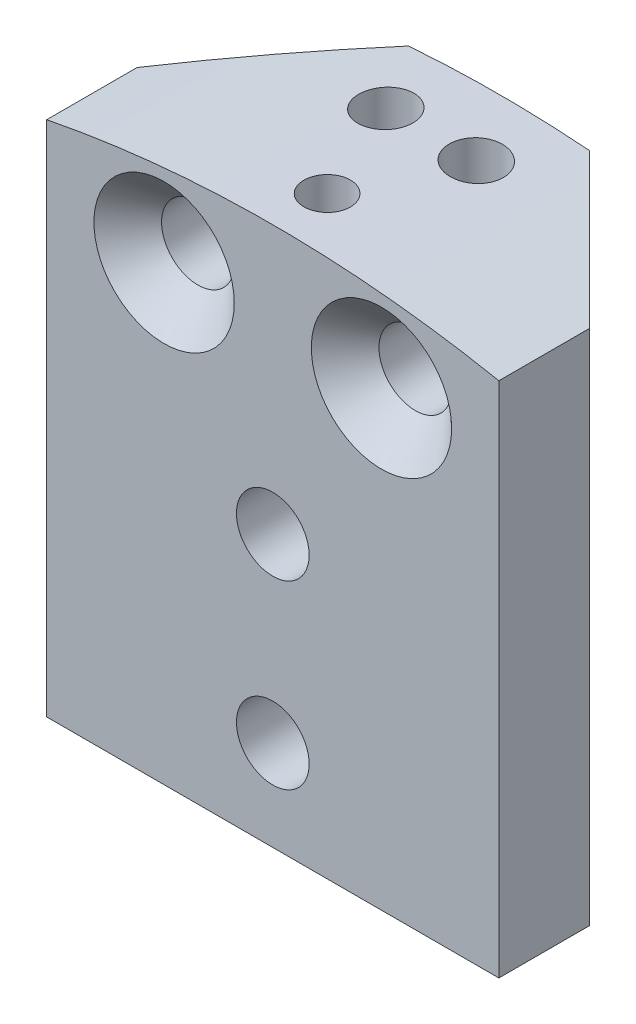
from build123d import *

# Parameters (mm, degrees)
SKETCH1_W                    = 50.8
SKETCH1_H                    = 38.1
BOSS_EXTRUDE1_DEPTH          = 15.875
F_1_4_20_TAPPED_HOLE1_D      = 5.1054
CUT_EXTRUDE1_DEPTH           = 36.497579143
CUT_EXTRUDE1_DEPTH_BACK      = 36.497579143
SKETCH5_W                    = 73.284203365
SKETCH5_H                    = 114.763304797
CUT_EXTRUDE3_DEPTH           = 36.497579143
CUT_EXTRUDE3_DRAFT           = 45
CUT_EXTRUDE3_PROFILE_2_DEPTH = 36.497579143
CUT_EXTRUDE3_PROFILE_2_DRAFT = 45
CUT_EXTRUDE5_DEPTH           = 34.299680929
CUT_EXTRUDE5_DEPTH_BACK      = 34.299680929
SKETCH7_W                    = 138.535058429
SKETCH7_H                    = 124.054324336
SKETCH7_W_2                  = 31.75
SKETCH7_H_2                  = 70.377244636
F_1_4_20_TAPPED_HOLE2_D      = 5.1054
F_10_24_TAPPED_HOLE2_D       = 3.7973
F_10_24_TAPPED_HOLE2_DEPTH   = 12.7
F_10_24_TAPPED_HOLE2_TIP     = 1.140824014
CUT_EXTRUDE6_DEPTH           = 6.35


with BuildPart() as part:
    # Sketch1 → Boss-Extrude1 (new body)
    with BuildSketch(Plane.XY):
        Rectangle(SKETCH1_W, SKETCH1_H)
    extrude(amount=BOSS_EXTRUDE1_DEPTH)

    # 1/4-20 Tapped Hole1 (through all)
    with Locations(Plane.XY.offset(15.875)):
        with Locations((7.6327, 12.7), (-7.6327, 12.7)):
            Hole(F_1_4_20_TAPPED_HOLE1_D / 2)

    # Sketch4 → Cut-Extrude1 (cut, two sides: drawn at the far end of the back side and taken through both)
    with BuildSketch(Plane.XY.offset(15.875).offset(-CUT_EXTRUDE1_DEPTH_BACK)):
        with BuildLine():
            Line((-39.282326984, 8.793789894), (-52.704404265, 33.364356416))
            Line((-52.704404265, 33.364356416), (0, 61.927684543))
            Line((0, 61.927684543), (62.667848215, 36.771765562))
            Line((62.667848215, 36.771765562), (48.5918884, 2.86093959))
            ThreePointArc((48.5918884, 2.86093959), (5.519661368, 18.637515941), (-39.282326984, 8.793789894))
        make_face()
    extrude(amount=CUT_EXTRUDE1_DEPTH + CUT_EXTRUDE1_DEPTH_BACK, mode=Mode.SUBTRACT)


with BuildPart() as cut_extrude3_tool:
    # Sketch5 → Cut-Extrude3 (with draft: the straight prism first)
    with BuildSketch(Plane.XY):
        with Locations((-42.992101682, 7.874882724)):
            Rectangle(SKETCH5_W, SKETCH5_H)
    extrude(amount=CUT_EXTRUDE3_DEPTH)
    # Cut-Extrude3: the draft: its side faces are tilted about the plane it starts from
    cut_extrude3_sides = [cut_extrude3_tool.faces().sort_by_distance(p)[0] for p in [
        (-42.992101682, 65.256535122, 18.248789571),
        (-79.634203365, 7.874882724, 18.248789571),
        (-42.992101682, -49.506769675, 18.248789571),
        (-6.35, 7.874882724, 18.248789571),
    ]]
    draft(cut_extrude3_sides, Plane.XY, CUT_EXTRUDE3_DRAFT)


with BuildPart() as part_1:
    add(part.part)

    # Cut-Extrude3: cut by cut_extrude3_tool
    add(cut_extrude3_tool.part, mode=Mode.SUBTRACT)


with BuildPart() as cut_extrude3_profile_2_tool:
    # Sketch5 → Cut-Extrude3 profile 2 (with draft: the straight prism first)
    with BuildSketch(Plane.XY):
        with Locations((42.992101682, 7.874882724)):
            Rectangle(SKETCH5_W, SKETCH5_H)
    extrude(amount=CUT_EXTRUDE3_PROFILE_2_DEPTH)
    # Cut-Extrude3 profile 2: the draft: its side faces are tilted about the plane it starts from
    cut_extrude3_profile_2_sides = [cut_extrude3_profile_2_tool.faces().sort_by_distance(p)[0] for p in [
        (42.992101682, 65.256535122, 18.248789571),
        (6.35, 7.874882724, 18.248789571),
        (42.992101682, -49.506769675, 18.248789571),
        (79.634203365, 7.874882724, 18.248789571),
    ]]
    draft(cut_extrude3_profile_2_sides, Plane.XY, CUT_EXTRUDE3_PROFILE_2_DRAFT)


with BuildPart() as part_2:
    add(part_1.part)

    # Cut-Extrude3 profile 2: cut by cut_extrude3_profile_2_tool
    add(cut_extrude3_profile_2_tool.part, mode=Mode.SUBTRACT)

    # Cut-Extrude4 cone 1 section (through the dimple's axis) → Cut-Extrude4 (revolve, cut)
    with BuildSketch(Plane(origin=(-7.6327, 12.7, 15.875), x_dir=(0, -1, 0), z_dir=(1, 0, 0))):
        Polygon((0, 0), (4.9276, 0), (0, 4.9276), align=None)
    revolve(axis=Axis((-7.6327, 12.7, 15.875), (0, 0, -1)), mode=Mode.SUBTRACT)

    # Cut-Extrude4 cone 2 section (through the dimple's axis) → Cut-Extrude4 cone 2 (revolve, cut)
    with BuildSketch(Plane(origin=(7.6327, 12.7, 15.875), x_dir=(0, -1, 0), z_dir=(1, 0, 0))):
        Polygon((0, 0), (4.9276, 0), (0, 4.9276), align=None)
    revolve(axis=Axis((7.6327, 12.7, 15.875), (0, 0, -1)), mode=Mode.SUBTRACT)

    # Sketch7 → Cut-Extrude5 (cut, two sides: drawn at the far end of the back side and taken through both)
    with BuildSketch(Plane.XY.offset(15.875).offset(-CUT_EXTRUDE5_DEPTH_BACK)):
        with Locations((-4.796027088, -12.18557991)):
            Rectangle(SKETCH7_W, SKETCH7_H)
        Rectangle(SKETCH7_W_2, SKETCH7_H_2, mode=Mode.SUBTRACT)
    extrude(amount=CUT_EXTRUDE5_DEPTH + CUT_EXTRUDE5_DEPTH_BACK, mode=Mode.SUBTRACT)

    # 1/4-20 Tapped Hole2 (through all)
    with Locations(Plane.XY.offset(15.875)):
        with Locations((0, -12.7), (0, 0)):
            Hole(F_1_4_20_TAPPED_HOLE2_D / 2)

    # #10-24 Tapped Hole2
    with Locations(Plane(origin=(0, 19.05, 0), x_dir=(-1, 0, 0), z_dir=(0, 1, 0))):
        with Locations((3.175, 4.7625), (-3.175, 4.7625)):
            Hole(F_10_24_TAPPED_HOLE2_D / 2, depth=F_10_24_TAPPED_HOLE2_DEPTH)
            with Locations((0, 0, -(F_10_24_TAPPED_HOLE2_DEPTH + F_10_24_TAPPED_HOLE2_TIP / 2))):  # 118° drill point
                Cone(0, F_10_24_TAPPED_HOLE2_D / 2, F_10_24_TAPPED_HOLE2_TIP, mode=Mode.SUBTRACT)

    # Sketch13 → Cut-Extrude6 (cut)
    with BuildSketch(Plane(origin=(0, 19.05, 0), x_dir=(-1, 0, 0), z_dir=(0, -1, 0))):
        with BuildLine():
            add(Edge.make_bspline(
                [(1.630169721, -12.065), (1.630169721, -8.8011), (-1.633730278, -8.8011), (-1.633730278, -12.065), (-1.633730278, -15.3289), (1.630169721, -15.3289), (1.630169721, -12.065)],
                knots=[0, 0, 0, 0, 0.5, 0.5, 0.5, 1, 1, 1, 1], degree=3, weights=[1, 0.333333333, 0.333333333, 1, 0.333333333, 0.333333333, 1]))
        make_face()
    extrude(amount=CUT_EXTRUDE6_DEPTH, mode=Mode.SUBTRACT)


solid = part_2.part
